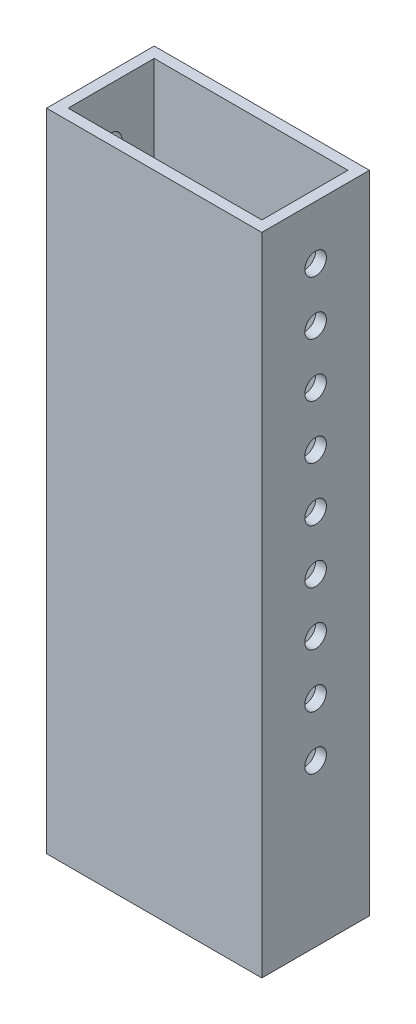
from build123d import *

# Parameters (mm, degrees)
SKETCH1_W           = 50.8
SKETCH1_H           = 25.4
SKETCH1_W_2         = 45.72
SKETCH1_H_2         = 20.32
BOSS_EXTRUDE2_DEPTH = 152.4
SKETCH2_R           = 2.54
CUT_EXTRUDE1_DEPTH  = 127


with BuildPart() as part:
    # Sketch1 → Boss-Extrude2 (new body)
    with BuildSketch(Plane(origin=(0, 0, 0), x_dir=(1, 0, 0), z_dir=(0, 1, 0))):
        with Locations((-34.550728477, 5.021125828)):
            Rectangle(SKETCH1_W, SKETCH1_H)
        with Locations((-34.550728477, 5.021125828)):
            Rectangle(SKETCH1_W_2, SKETCH1_H_2, mode=Mode.SUBTRACT)
    extrude(amount=BOSS_EXTRUDE2_DEPTH)

    # Sketch2 → Cut-Extrude1 (cut)
    with BuildSketch(Plane(origin=(-9.150728477, 0, 0), x_dir=(0, 0, -1), z_dir=(1, 0, 0))):
        with Locations((5.021125828, 139.7)):
            Circle(SKETCH2_R)
        with Locations((5.021125828, 127)):
            Circle(SKETCH2_R)
        with Locations((5.021125828, 114.3)):
            Circle(SKETCH2_R)
        with Locations((5.021125828, 101.6)):
            Circle(SKETCH2_R)
        with Locations((5.021125828, 88.9)):
            Circle(SKETCH2_R)
        with Locations((5.021125828, 76.2)):
            Circle(SKETCH2_R)
        with Locations((5.021125828, 63.5)):
            Circle(SKETCH2_R)
        with Locations((5.021125828, 50.8)):
            Circle(SKETCH2_R)
        with Locations((5.021125828, 38.1)):
            Circle(SKETCH2_R)
    extrude(amount=-CUT_EXTRUDE1_DEPTH, mode=Mode.SUBTRACT)


solid = part.part
